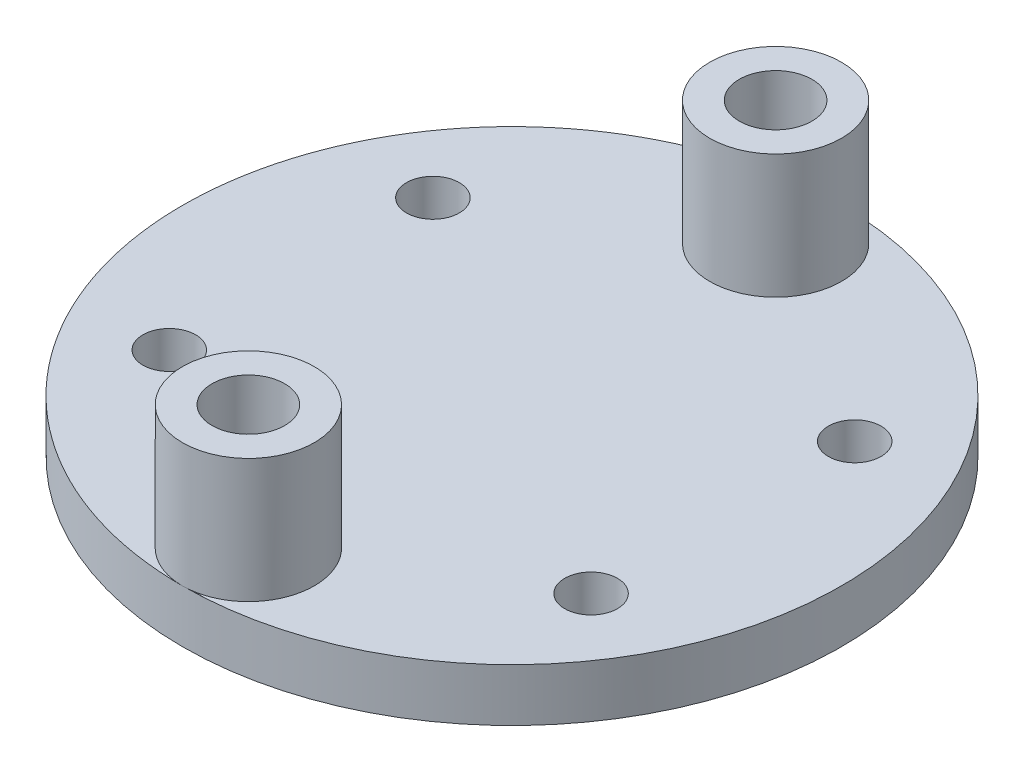
from build123d import *

# Parameters (mm, degrees)
SKETCH1_R           = 15.875
SKETCH1_R_2         = 1.27
SKETCH1_R_3         = 1.75
BOSS_EXTRUDE1_DEPTH = 2.54
SKETCH2_R           = 3.175
SKETCH2_R_2         = 1.75
BOSS_EXTRUDE2_DEPTH = 5.974999988


with BuildPart() as part:
    # Sketch1 → Boss-Extrude1 (new body)
    with BuildSketch(Plane(origin=(0, 0, 0), x_dir=(1, 0, 0), z_dir=(0, 1, 0))):
        with Locations((12.7, 8.89)):
            Circle(SKETCH1_R)
        with Locations((2.54, 2.54)):
            Circle(SKETCH1_R_2, mode=Mode.SUBTRACT)
        with Locations((22.86, 2.54)):
            Circle(SKETCH1_R_2, mode=Mode.SUBTRACT)
        with Locations((2.54, 15.24)):
            Circle(SKETCH1_R_2, mode=Mode.SUBTRACT)
        with Locations((22.86, 15.24)):
            Circle(SKETCH1_R_2, mode=Mode.SUBTRACT)
        with Locations((12.7, -3.81)):
            Circle(SKETCH1_R_3, mode=Mode.SUBTRACT)
        with Locations((12.7, 21.59)):
            Circle(SKETCH1_R_3, mode=Mode.SUBTRACT)
    extrude(amount=BOSS_EXTRUDE1_DEPTH)

    # Sketch2 → Boss-Extrude2 (add)
    # profile 1 of 2: a face of its own
    with BuildSketch(Plane(origin=(0, 2.54, 0), x_dir=(1, 0, 0), z_dir=(0, 1, 0))):
        with Locations((12.7, 21.59)):
            Circle(SKETCH2_R)
        with Locations((12.7, 21.59)):
            Circle(SKETCH2_R_2, mode=Mode.SUBTRACT)
    # profile 2 of 2: a face of its own
    with BuildSketch(Plane(origin=(0, 2.54, 0), x_dir=(1, 0, 0), z_dir=(0, 1, 0))):
        with Locations((12.7, -3.81)):
            Circle(SKETCH2_R)
        with Locations((12.7, -3.81)):
            Circle(SKETCH2_R_2, mode=Mode.SUBTRACT)
    extrude(amount=BOSS_EXTRUDE2_DEPTH)


solid = part.part
